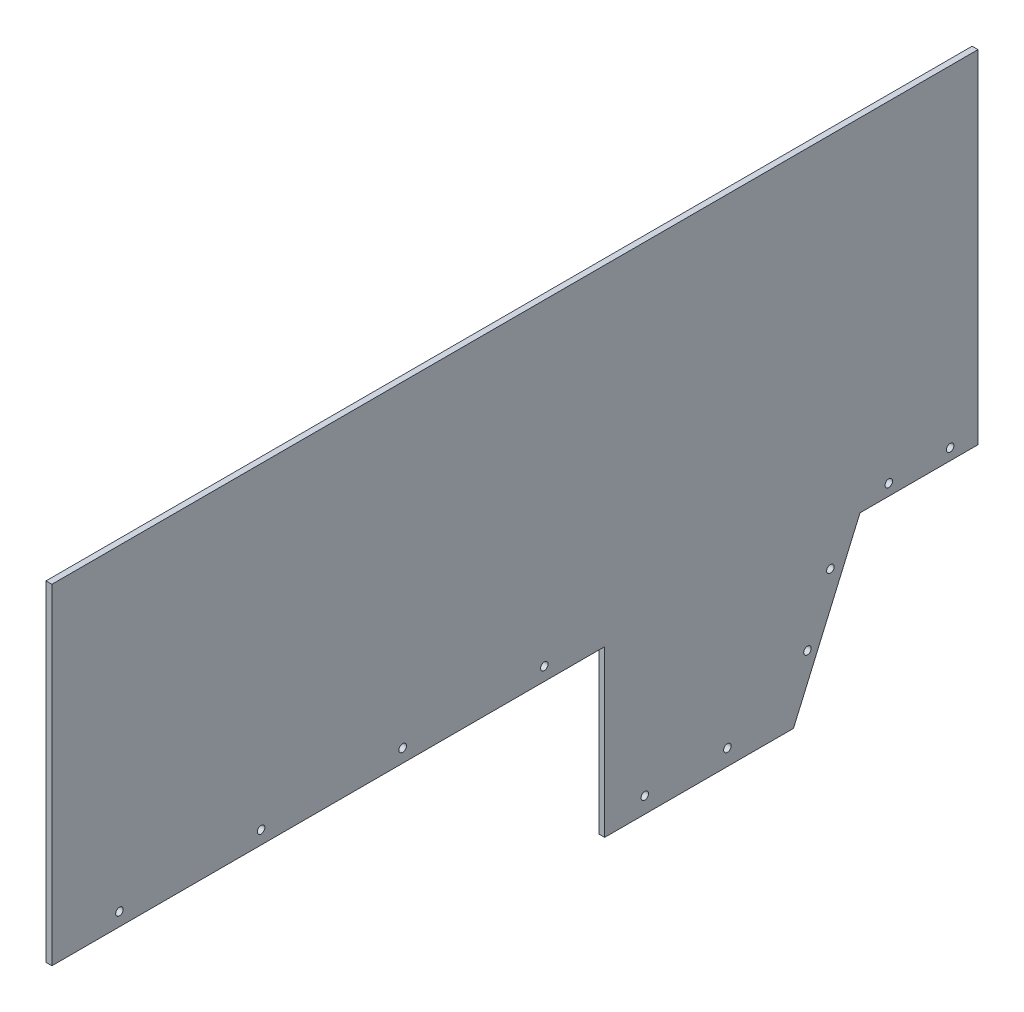
from build123d import *

# Parameters (mm, degrees)
SKETCH1_W           = 498.348
SKETCH1_H           = 177.8
BOSS_EXTRUDE1_DEPTH = 1.5875
BOSS_EXTRUDE2_DEPTH = 3.175
SKETCH3_R           = 2.025
CUT_EXTRUDE1_DEPTH  = 307.121875894
LPATTERN1_COUNT     = 4
LPATTERN1_PITCH     = 76.2
SKETCH4_R           = 2.025
CUT_EXTRUDE2_DEPTH  = 307.121875894
LPATTERN2_COUNT     = 2
LPATTERN2_PITCH     = 44.45
CUT_EXTRUDE3_DEPTH  = 307.121875894
CUT_EXTRUDE5_DEPTH  = 307.121875894
CUT_EXTRUDE6_DEPTH  = 307.121875894
LPATTERN4_COUNT     = 2
LPATTERN4_PITCH     = 33.02


with BuildPart() as part:
    # Sketch1 → Boss-Extrude1 (new, symmetric)
    with BuildSketch(Plane(origin=(0, 0, 0), x_dir=(0, 0, -1), z_dir=(1, 0, 0))):
        Rectangle(SKETCH1_W, SKETCH1_H)
    extrude(amount=BOSS_EXTRUDE1_DEPTH, both=True)

    # Sketch2 → Boss-Extrude2 (add)
    with BuildSketch(Plane(origin=(1.5875, 0, 0), x_dir=(0, 0, -1), z_dir=(1, 0, 0))):
        Polygon((249.174, -95.25), (249.174, -88.9), (48.2854, -88.9), (48.2854, -177.8), (149.8854, -177.8), (185.674, -95.25), align=None)
    extrude(amount=-BOSS_EXTRUDE2_DEPTH)

    # Sketch3 → Cut-Extrude1 (cut, through all)
    with BuildSketch(Plane(origin=(1.5875, 0, 0), x_dir=(0, 0, -1), z_dir=(1, 0, 0))):
        with Locations((15.7854, -81.770353604)):
            Circle(SKETCH3_R)
    cut_extrude1 = extrude(amount=-CUT_EXTRUDE1_DEPTH, mode=Mode.SUBTRACT)

    # LPattern1: Cut-Extrude1 ×4
    with Locations(*[(0, 0, i * LPATTERN1_PITCH) for i in range(1, LPATTERN1_COUNT)]):
        add(cut_extrude1, mode=Mode.SUBTRACT)

    # Sketch4 → Cut-Extrude2 (cut, through all)
    with BuildSketch(Plane.ZY.offset(1.5875)):
        with Locations((-69.8754, -169.164)):
            Circle(SKETCH4_R)
    cut_extrude2 = extrude(amount=-CUT_EXTRUDE2_DEPTH, mode=Mode.SUBTRACT)

    # LPattern2: Cut-Extrude2 ×2
    with Locations(*[(0, 0, -i * LPATTERN2_PITCH) for i in range(1, LPATTERN2_COUNT)]):
        add(cut_extrude2, mode=Mode.SUBTRACT)

    # Sketch5 → Cut-Extrude3 (cut, through all)
    with BuildSketch(Plane.ZY.offset(1.5875)):
        with BuildLine():
            ThreePointArc((-159.269203215, -146.048365181), (-156.99998017, -147.225677073), (-155.386292141, -145.242889272))
            ThreePointArc((-155.386292141, -145.242889272), (-157.822604112, -143.260101471), (-159.269203215, -146.048365181))
        make_face()
    extrude(amount=-CUT_EXTRUDE3_DEPTH, mode=Mode.SUBTRACT)

    # Sketch8 → Cut-Extrude5 (cut, through all)
    with BuildSketch(Plane.ZY.offset(1.5875)):
        with BuildLine():
            ThreePointArc((-170.124131866, -115.334522773), (-168.455922107, -114.903970315), (-167.723008719, -113.344759878))
            ThreePointArc((-167.723008719, -113.344759878), (-171.040095332, -111.785549441), (-170.124131866, -115.334522773))
        make_face()
    extrude(amount=-CUT_EXTRUDE5_DEPTH, mode=Mode.SUBTRACT)

    # Sketch9 → Cut-Extrude6 (cut, through all)
    with BuildSketch(Plane.ZY.offset(1.5875)):
        with BuildLine():
            ThreePointArc((-201.170653386, -91.179), (-199.738762154, -90.585891232), (-199.145653386, -89.154))
            ThreePointArc((-199.145653386, -89.154), (-202.602544618, -87.722108768), (-201.170653386, -91.179))
        make_face()
    cut_extrude6 = extrude(amount=-CUT_EXTRUDE6_DEPTH, mode=Mode.SUBTRACT)

    # LPattern4: Cut-Extrude6 ×2
    with Locations(*[(0, 0, -i * LPATTERN4_PITCH) for i in range(1, LPATTERN4_COUNT)]):
        add(cut_extrude6, mode=Mode.SUBTRACT)


solid = part.part
